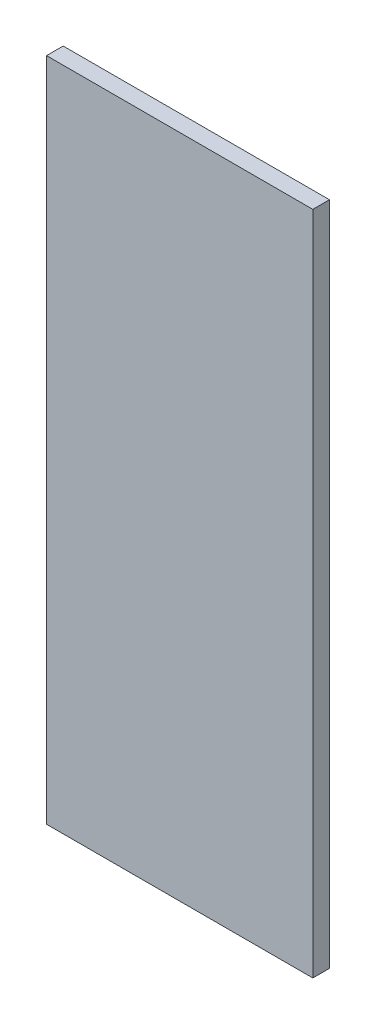
from build123d import *

# Parameters (mm, degrees)
SKETCH1_W           = 101.6
SKETCH1_H           = 254
BOSS_EXTRUDE1_DEPTH = 6.35


with BuildPart() as part:
    # Sketch1 → Boss-Extrude1 (new body)
    with BuildSketch(Plane.XY):
        with Locations((50.8, 127)):
            Rectangle(SKETCH1_W, SKETCH1_H)
    extrude(amount=BOSS_EXTRUDE1_DEPTH)


solid = part.part
